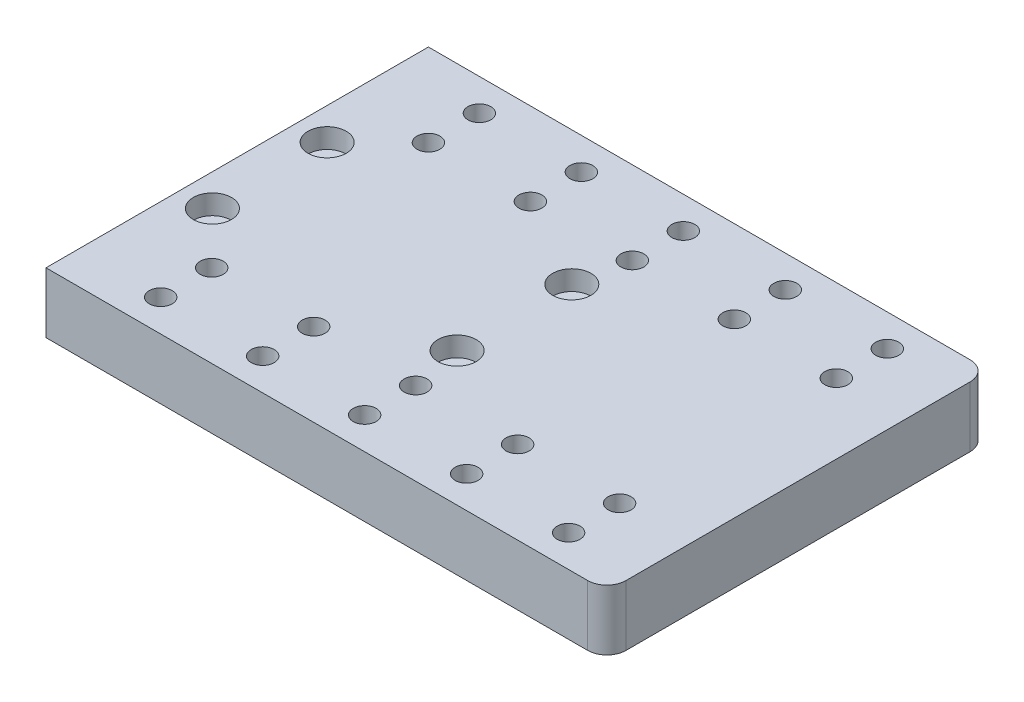
from build123d import *

# Parameters (mm, degrees)
SKETCH_1_W             = 88
SKETCH_1_H             = 60
EXTRUDE_1_DEPTH        = 9.5
FILLET_1_R             = 3
SKETCH_2_R             = 1.3
CUT_EXTRUDE_1_DEPTH    = 55.094824152
SKETCH_3_R             = 3
CUT_EXTRUDE_2_DEPTH    = 3.1
SKETCH_4_R             = 1.8
CUT_EXTRUDE_3_DEPTH    = 55.094824152
PATTERN_LINEAR_1_COUNT = 5
PATTERN_LINEAR_1_PITCH = 16


with BuildPart() as part:
    # 草图1 → 凸台-拉伸1 (new body)
    with BuildSketch(Plane(origin=(0, 0, 0), x_dir=(1, 0, 0), z_dir=(0, 1, 0))):
        Rectangle(SKETCH_1_W, SKETCH_1_H)
    extrude(amount=EXTRUDE_1_DEPTH)

    # 圆角1
    fillet_1_edges = [part.edges().sort_by_distance(p)[0] for p in [
        (44, 4.75, -30),
        (44, 4.75, 30),
    ]]
    fillet(fillet_1_edges, radius=FILLET_1_R)

    # 草图2 → 切除-拉伸1 (cut, through all)
    with BuildSketch(Plane(origin=(0, 9.5, 0), x_dir=(1, 0, 0), z_dir=(0, 1, 0))):
        with Locations((-39, -8.88983487)):
            Circle(SKETCH_2_R)
        with Locations((-39, 9.11016513)):
            Circle(SKETCH_2_R)
        with Locations((-0.5, 9)):
            Circle(SKETCH_2_R)
        with Locations((-0.5, -9)):
            Circle(SKETCH_2_R)
    extrude(amount=-CUT_EXTRUDE_1_DEPTH, mode=Mode.SUBTRACT)

    # 草图3 → 切除-拉伸2 (cut)
    with BuildSketch(Plane(origin=(0, 9.5, 0), x_dir=(1, 0, 0), z_dir=(0, 1, 0))):
        with Locations((-39, -8.88983487)):
            Circle(SKETCH_3_R)
        with Locations((-39, 9.11016513)):
            Circle(SKETCH_3_R)
        with Locations((-0.5, -9)):
            Circle(SKETCH_3_R)
        with Locations((-0.5, 9)):
            Circle(SKETCH_3_R)
    extrude(amount=-CUT_EXTRUDE_2_DEPTH, mode=Mode.SUBTRACT)

    # 草图4 → 切除-拉伸3 (cut, through all)
    with BuildSketch(Plane(origin=(0, 9.5, 0), x_dir=(1, 0, 0), z_dir=(0, 1, 0))):
        with Locations((-31, -25)):
            Circle(SKETCH_4_R)
        with Locations((-31, 25)):
            Circle(SKETCH_4_R)
        with Locations((-31, -17)):
            Circle(SKETCH_4_R)
        with Locations((-31, 17)):
            Circle(SKETCH_4_R)
    cut_extrude_3 = extrude(amount=-CUT_EXTRUDE_3_DEPTH, mode=Mode.SUBTRACT)

    # 阵列(线性)1: 切除-拉伸3 ×5
    with Locations(*[(i * PATTERN_LINEAR_1_PITCH, 0, 0) for i in range(1, PATTERN_LINEAR_1_COUNT)]):
        add(cut_extrude_3, mode=Mode.SUBTRACT)


solid = part.part
